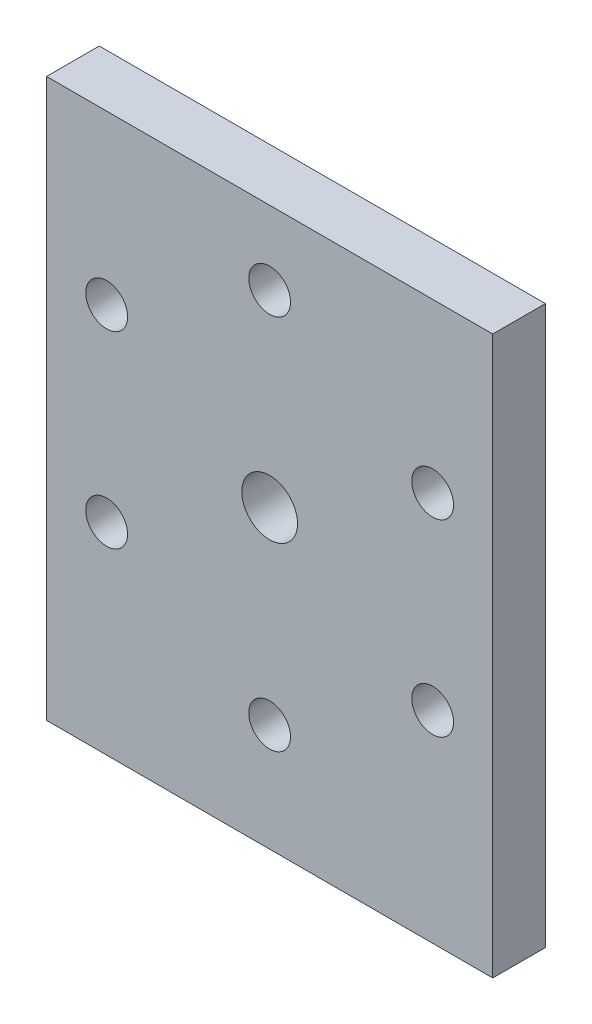
from build123d import *

# Parameters (mm, degrees)
SKETCH1_W           = 101.6
SKETCH1_H           = 127
SKETCH1_R           = 6.35
SKETCH1_R_2         = 4.7625
BOSS_EXTRUDE1_DEPTH = 12.0000014


with BuildPart() as part:
    # Sketch1 → Boss-Extrude1 (new body)
    with BuildSketch(Plane.XY):
        with Locations((0, 63.5)):
            Rectangle(SKETCH1_W, SKETCH1_H)
        with Locations((0, 67.3749986)):
            Circle(SKETCH1_R, mode=Mode.SUBTRACT)
        with Locations((-37.12001387, 45.9437486)):
            Circle(SKETCH1_R_2, mode=Mode.SUBTRACT)
        with Locations((37.12001387, 45.9437486)):
            Circle(SKETCH1_R_2, mode=Mode.SUBTRACT)
        with Locations((0, 24.5124986)):
            Circle(SKETCH1_R_2, mode=Mode.SUBTRACT)
        with Locations((-37.12001387, 88.8062486)):
            Circle(SKETCH1_R_2, mode=Mode.SUBTRACT)
        with Locations((37.12001387, 88.8062486)):
            Circle(SKETCH1_R_2, mode=Mode.SUBTRACT)
        with Locations((0, 110.2374986)):
            Circle(SKETCH1_R_2, mode=Mode.SUBTRACT)
    extrude(amount=BOSS_EXTRUDE1_DEPTH)


solid = part.part
